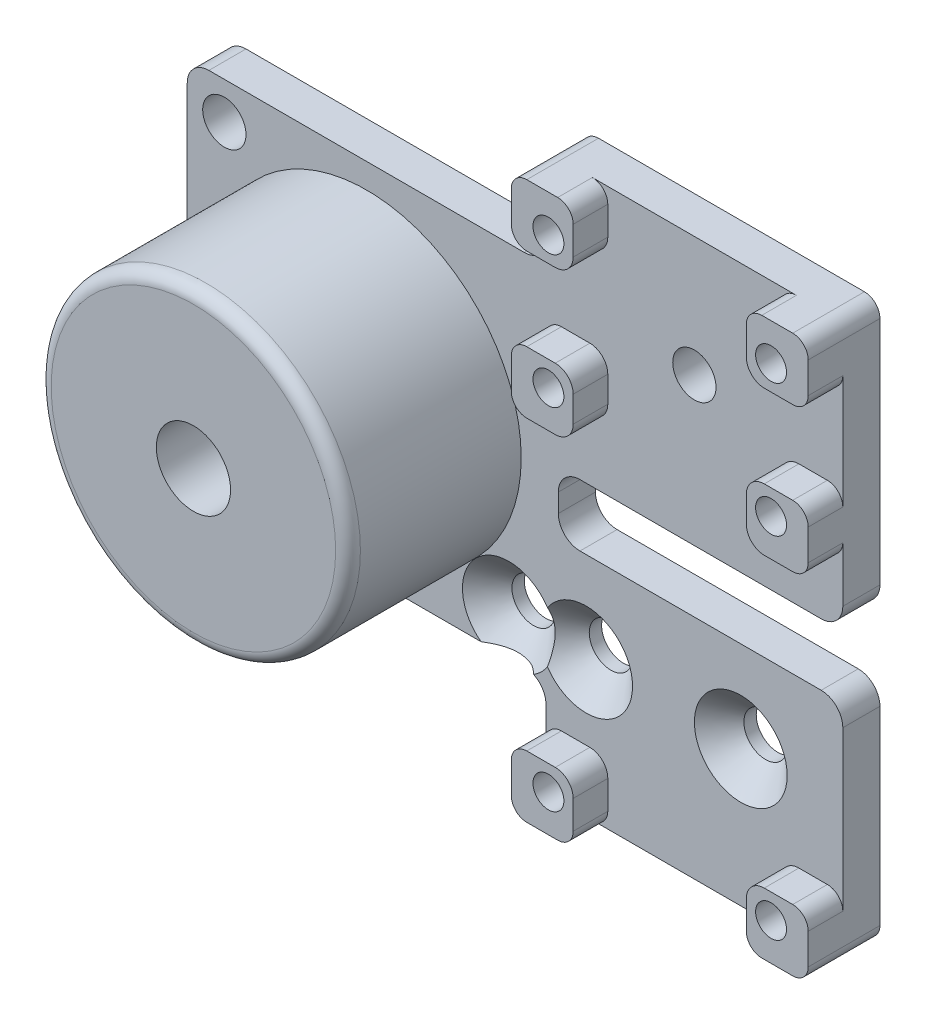
from build123d import *

# Parameters (mm, degrees)
ESQUISSE1_R             = 10.5
ESQUISSE1_R_2           = 1.75
BOSS_EXTRU_1_DEPTH      = 3
ESQUISSE1_3_R           = 12.5
ESQUISSE1_3_R_2         = 3
BOSS_EXTRU_2_DEPTH      = 17
ESQUISSE1_5_R           = 10.5
ENL_V_MAT_EXTRU_1_DEPTH = 10
ESQUISSE4_R             = 1.25
ESQUISSE4_R_2           = 1.75
BOSS_EXTRU_4_DEPTH      = 3
ESQUISSE4_3_W           = 5
ESQUISSE4_3_H           = 5
ESQUISSE4_3_R           = 1.25
BOSS_EXTRU_5_DEPTH      = 5.8
CONG_4_R                = 1.75
CONG_5_R                = 1.25
CONG_6_R                = 1.45
CHANFREIN2_SIZE         = 2
ESQUISSE5_R             = 2.5
ENL_V_MAT_EXTRU_5_DEPTH = 2.8
CONG_7_R                = 1


with BuildPart() as part:
    # Esquisse1 → Boss.-Extru.1 (new body)
    with BuildSketch(Plane.XY):
        with BuildLine():
            Line((0, 14.5), (-14.5, 14.5))
            Line((-14.5, 14.5), (-14.5, -14.5))
            Line((-14.5, -14.5), (14.5, -14.5))
            Line((14.5, -14.5), (14.5, 0))
            ThreePointArc((14.5, 0), (10.253048327, 10.253048327), (0, 14.5))
        make_face()
        Circle(ESQUISSE1_R, mode=Mode.SUBTRACT)
        with Locations((-11.5, 11.5)):
            Circle(ESQUISSE1_R_2, mode=Mode.SUBTRACT)
        with Locations((11.5, -11.5)):
            Circle(ESQUISSE1_R_2, mode=Mode.SUBTRACT)
        with Locations((-11.5, -11.5)):
            Circle(ESQUISSE1_R_2, mode=Mode.SUBTRACT)
    extrude(amount=BOSS_EXTRU_1_DEPTH)

    # Esquisse1<3> → Boss.-Extru.2 (add)
    with BuildSketch(Plane.XY):
        Circle(ESQUISSE1_3_R)
        Circle(ESQUISSE1_3_R_2, mode=Mode.SUBTRACT)
    extrude(amount=BOSS_EXTRU_2_DEPTH)

    # Esquisse1<5> → Enlèv. mat.-Extru.1 (cut)
    with BuildSketch(Plane.XY):
        Circle(ESQUISSE1_5_R)
    extrude(amount=ENL_V_MAT_EXTRU_1_DEPTH, mode=Mode.SUBTRACT)

    # Esquisse4 → Boss.-Extru.4 (add)
    with BuildSketch(Plane(origin=(0, 0, 0), x_dir=(-1, 0, 0), z_dir=(0, 0, -1))):
        with BuildLine():
            Line((-14.5, 22.5), (-38.5, 22.5))
            Line((-38.5, 22.5), (-38.5, 0.85))
            Line((-38.5, 0.85), (-15.5, 0.85))
            Line((-15.5, 0.85), (-15.5, -4.15))
            Line((-15.5, -4.15), (-38.5, -4.15))
            Line((-38.5, -4.15), (-38.5, -22.5))
            Line((-38.5, -22.5), (-14.5, -22.5))
            Line((-14.5, -22.5), (-14.5, 0))
            ThreePointArc((-14.5, 0), (-10.253048327, 10.253048327), (0, 14.5))
            Line((0, 14.5), (-14.5, 14.5))
            Line((-14.5, 14.5), (-14.5, 22.5))
        make_face()
        with Locations((-17.5, 19.5)):
            Circle(ESQUISSE4_R, mode=Mode.SUBTRACT)
        with Locations((-17.750334005, -11.5)):
            Circle(ESQUISSE4_R_2, mode=Mode.SUBTRACT)
        with Locations((-26.5, 12.8)):
            Circle(ESQUISSE4_R_2, mode=Mode.SUBTRACT)
        with Locations((-30.250334005, -11.5)):
            Circle(ESQUISSE4_R_2, mode=Mode.SUBTRACT)
        with Locations((-35.5, 19.5)):
            Circle(ESQUISSE4_R, mode=Mode.SUBTRACT)
        with Locations((-17.5, 8.8)):
            Circle(ESQUISSE4_R, mode=Mode.SUBTRACT)
        with Locations((-17.5, -19.5)):
            Circle(ESQUISSE4_R, mode=Mode.SUBTRACT)
        with Locations((-35.5, 8.8)):
            Circle(ESQUISSE4_R, mode=Mode.SUBTRACT)
        with Locations((-35.5, -19.5)):
            Circle(ESQUISSE4_R, mode=Mode.SUBTRACT)
    extrude(amount=-BOSS_EXTRU_4_DEPTH)

    # Esquisse4<3> → Boss.-Extru.5 (add)
    # profile 1 of 6: a face of its own
    with BuildSketch(Plane(origin=(0, 0, 0), x_dir=(-1, 0, 0), z_dir=(0, 0, -1))):
        with Locations((-17, -20)):
            Rectangle(ESQUISSE4_3_W, ESQUISSE4_3_H)
        with Locations((-17.5, -19.5)):
            Circle(ESQUISSE4_3_R, mode=Mode.SUBTRACT)
    # profile 2 of 6: a face of its own
    with BuildSketch(Plane(origin=(0, 0, 0), x_dir=(-1, 0, 0), z_dir=(0, 0, -1))):
        with Locations((-36, -20)):
            Rectangle(ESQUISSE4_3_W, ESQUISSE4_3_H)
        with Locations((-35.5, -19.5)):
            Circle(ESQUISSE4_3_R, mode=Mode.SUBTRACT)
    # profile 3 of 6: a face of its own
    with BuildSketch(Plane(origin=(0, 0, 0), x_dir=(-1, 0, 0), z_dir=(0, 0, -1))):
        with Locations((-36, 8.3)):
            Rectangle(ESQUISSE4_3_W, ESQUISSE4_3_H)
        with Locations((-35.5, 8.8)):
            Circle(ESQUISSE4_3_R, mode=Mode.SUBTRACT)
    # profile 4 of 6: a face of its own
    with BuildSketch(Plane(origin=(0, 0, 0), x_dir=(-1, 0, 0), z_dir=(0, 0, -1))):
        with Locations((-36, 20)):
            Rectangle(ESQUISSE4_3_W, ESQUISSE4_3_H)
        with Locations((-35.5, 19.5)):
            Circle(ESQUISSE4_3_R, mode=Mode.SUBTRACT)
    # profile 5 of 6: a face of its own
    with BuildSketch(Plane(origin=(0, 0, 0), x_dir=(-1, 0, 0), z_dir=(0, 0, -1))):
        with Locations((-17, 20)):
            Rectangle(ESQUISSE4_3_W, ESQUISSE4_3_H)
        with Locations((-17.5, 19.5)):
            Circle(ESQUISSE4_3_R, mode=Mode.SUBTRACT)
    # profile 6 of 6: a face of its own
    with BuildSketch(Plane(origin=(0, 0, 0), x_dir=(-1, 0, 0), z_dir=(0, 0, -1))):
        with Locations((-17, 8.3)):
            Rectangle(ESQUISSE4_3_W, ESQUISSE4_3_H)
        with Locations((-17.5, 8.8)):
            Circle(ESQUISSE4_3_R, mode=Mode.SUBTRACT)
    extrude(amount=-BOSS_EXTRU_5_DEPTH)

    # Congé4
    cong_4_edges = [part.edges().sort_by_distance(p)[0] for p in [
        (14.5, -14.5, 1.5),
        (-14.5, -14.5, 1.5),
        (-14.5, 14.5, 1.5),
        (38.5, -4.15, 1.5),
        (15.5, -4.15, 1.5),
        (15.5, 0.85, 1.5),
        (38.5, 0.85, 1.5),
        (14.5, 14.5, 1.5),
    ]]
    fillet(cong_4_edges, radius=CONG_4_R)

    # Congé5
    cong_5_edges = [part.edges().sort_by_distance(p)[0] for p in [
        (19.5, -22.5, 4.4),
        (14.5, -17.5, 4.4),
        (38.5, -17.5, 4.4),
        (33.5, -22.5, 4.4),
        (38.5, 10.8, 4.4),
        (38.5, 5.8, 4.4),
        (33.5, 22.5, 4.4),
        (38.5, 17.5, 4.4),
        (19.5, 22.5, 4.4),
        (14.5, 17.5, 4.4),
        (14.5, 10.8, 4.4),
        (14.5, 5.8, 4.4),
        (14.5, -22.5, 2.9),
        (38.5, -22.5, 2.9),
        (38.5, 22.5, 2.9),
        (14.5, 22.5, 2.9),
    ]]
    fillet(cong_5_edges, radius=CONG_5_R)

    # Congé6
    cong_6_edges = [part.edges().sort_by_distance(p)[0] for p in [
        (19.5, -17.5, 4.4),
        (33.5, -17.5, 4.4),
        (33.5, 10.8, 4.4),
        (33.5, 5.8, 4.4),
        (33.5, 17.5, 4.4),
        (19.5, 17.5, 4.4),
        (19.5, 5.8, 4.4),
        (19.5, 10.8, 4.4),
    ]]
    fillet(cong_6_edges, radius=CONG_6_R)

    # Chanfrein2
    # the kernel refuses this chamfer: 2 mm, written as the material it takes off along each edge
    with BuildSketch(Plane(origin=(11.5, -11.5, 3), x_dir=(1, 0, 0), z_dir=(0, -1, 0))) as chanfrein2_piece_1:
        Polygon((1.75 + CHANFREIN2_SIZE, 0), (1.75, -CHANFREIN2_SIZE), (1.75, 0), align=None)
    revolve(axis=Axis((11.5, -11.5, 3), (0, 0, 1)), mode=Mode.SUBTRACT)
    with BuildSketch(Plane(origin=(17.750334005, -11.5, 3), x_dir=(-1, 0, 0), z_dir=(0, -1, 0))) as chanfrein2_piece_2:
        Polygon((1.75 + CHANFREIN2_SIZE, 0), (1.75, CHANFREIN2_SIZE), (1.75, 0), align=None)
    revolve(axis=Axis((17.750334005, -11.5, 3), (0, 0, -1)), mode=Mode.SUBTRACT)
    with BuildSketch(Plane(origin=(30.250334005, -11.5, 3), x_dir=(-1, 0, 0), z_dir=(0, -1, 0))) as chanfrein2_piece_3:
        Polygon((1.75 + CHANFREIN2_SIZE, 0), (1.75, CHANFREIN2_SIZE), (1.75, 0), align=None)
    revolve(axis=Axis((30.250334005, -11.5, 3), (0, 0, -1)), mode=Mode.SUBTRACT)

    # Esquisse5 → Enlèv. mat.-Extru.5 (cut)
    with BuildSketch(Plane(origin=(0, 0, 0), x_dir=(-1, 0, 0), z_dir=(0, 0, -1))):
        with Locations((-35.5, 19.5)):
            Circle(ESQUISSE5_R)
        with Locations((-17.5, 19.5)):
            Circle(ESQUISSE5_R)
        with Locations((-35.5, 8.8)):
            Circle(ESQUISSE5_R)
        with Locations((-17.5, 8.8)):
            Circle(ESQUISSE5_R)
    extrude(amount=-ENL_V_MAT_EXTRU_5_DEPTH, mode=Mode.SUBTRACT)

    # Congé7
    cong_7_edges = [part.edges().sort_by_distance(p)[0] for p in [
        (-12.5, 0, 17),
    ]]
    fillet(cong_7_edges, radius=CONG_7_R)


solid = part.part
